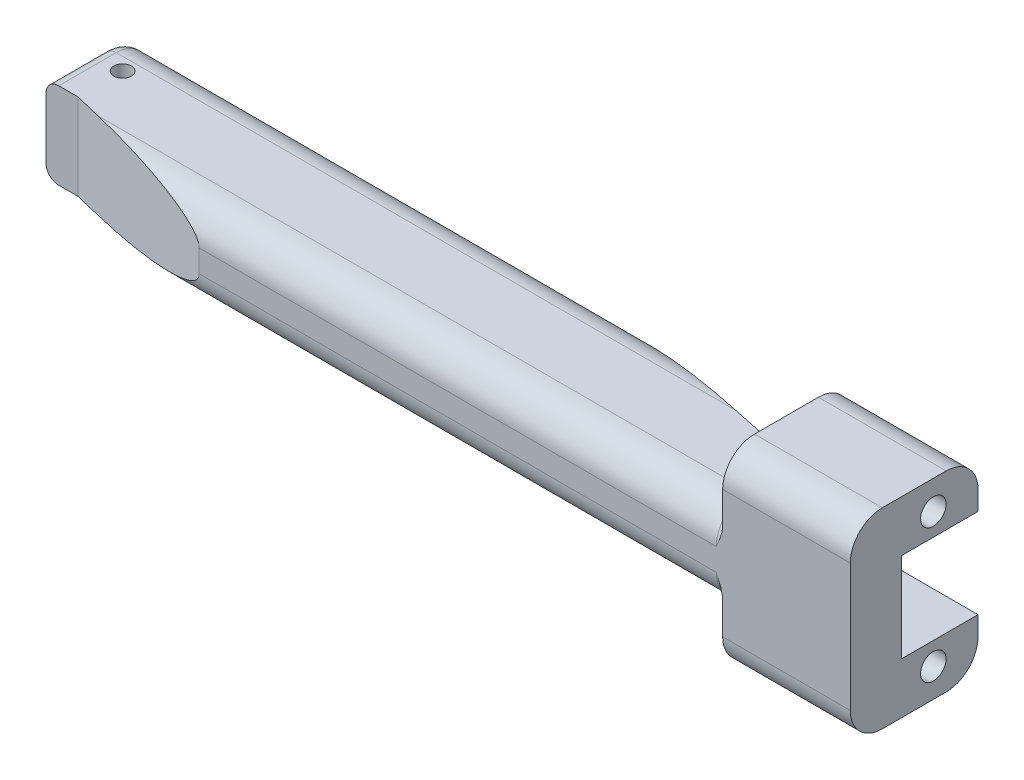
from build123d import *

# Parameters (mm, degrees)
ESQUISSE1_W                  = 132
ESQUISSE1_H                  = 30
BOSS_EXTRU_1_DEPTH           = 20
ESQUISSE3_W                  = 112
ESQUISSE3_H                  = 8.25
ENL_V_MAT_EXTRU_1_DEPTH      = 71.576199954
ENL_V_MAT_EXTRU_2_REACH      = 74.312
ESQUISSE4_R                  = 1.375
ESQUISSE5_R                  = 2
ENL_V_MAT_EXTRU_3_DEPTH      = 80
CONG_1_R                     = 5
CONG_2_R                     = 5
CONG_3_R                     = 1
ENL_V_MAT_EXTRU_4_DEPTH      = 7
ENL_V_MAT_EXTRU_4_DEPTH_BACK = 7
CONG_4_R                     = 2
ENL_V_MAT_EXTRU_5_DEPTH      = 71.576200076
ENL_V_MAT_EXTRU_5_DEPTH_BACK = 71.576200076


with BuildPart() as part:
    # Esquisse1 → Boss.-Extru.1 (new body)
    with BuildSketch(Plane.XY):
        Rectangle(ESQUISSE1_W, ESQUISSE1_H)
    extrude(amount=BOSS_EXTRU_1_DEPTH)

    # Esquisse3 → Enlèv. mat.-Extru.1 (cut, through all)
    with BuildSketch(Plane.XY.offset(20)):
        with Locations((-10, 10.875)):
            Rectangle(ESQUISSE3_W, ESQUISSE3_H)
        with Locations((-10, -10.875)):
            Rectangle(ESQUISSE3_W, ESQUISSE3_H)
    extrude(amount=-ENL_V_MAT_EXTRU_1_DEPTH, mode=Mode.SUBTRACT)

    # Esquisse4 → Enlèv. mat.-Extru.2 (cut, up to next)
    with BuildSketch(Plane.XZ.offset(6.75), mode=Mode.PRIVATE) as enl_v_mat_extru_2_sk1:
        with Locations(Location((-61, 7, 0), (0, 0, 270))):
            Circle(ESQUISSE4_R)
    enl_v_mat_extru_2_tool1 = extrude(enl_v_mat_extru_2_sk1.sketch, amount=-ENL_V_MAT_EXTRU_2_REACH, mode=Mode.PRIVATE) & part.part
    add(enl_v_mat_extru_2_tool1.solids().sort_by_distance((-61, -6.75, 7))[0], mode=Mode.SUBTRACT)

    # Esquisse5 → Enlèv. mat.-Extru.3 (cut)
    with BuildSketch(Plane.ZY.offset(-46)):
        with Locations(Location((7, -10.5, 0), (0, 0, 270))):
            Circle(ESQUISSE5_R)
        with Locations(Location((7, 10.5, 0), (0, 0, 270))):
            Circle(ESQUISSE5_R)
    extrude(amount=-ENL_V_MAT_EXTRU_3_DEPTH, mode=Mode.SUBTRACT)

    # Congé1
    cong_1_edges = [part.edges().sort_by_distance(p)[0] for p in [
        (56, -15, 0),
        (56, -15, 20),
        (56, 15, 0),
        (56, 15, 20),
    ]]
    fillet(cong_1_edges, radius=CONG_1_R)

    # Congé2
    cong_2_edges = [part.edges().sort_by_distance(p)[0] for p in [
        (-10, 6.75, 0),
        (-10, 6.75, 20),
        (-10, -6.75, 0),
        (-10, -6.75, 20),
    ]]
    fillet(cong_2_edges, radius=CONG_2_R)

    # Congé3
    # the kernel refuses this fillet: 1 mm, written as the material it adds along each edge
    with BuildSketch(Plane(origin=(46, -6.75, 15), x_dir=(0, -1, 0), z_dir=(0, 0, -1))) as cong_3_piece_1:
        with BuildLine():
            CenterArc((CONG_3_R, CONG_3_R), CONG_3_R, 180, 90)
            Line((0, CONG_3_R), (0, 0))
            Line((0, 0), (CONG_3_R, 0))
        make_face()
    extrude(amount=10)
    with BuildSketch(Plane(origin=(46, 6.75, 15), x_dir=(0, 1, 0), z_dir=(0, 0, -1))) as cong_3_piece_2:
        with BuildLine():
            CenterArc((CONG_3_R, -CONG_3_R), CONG_3_R, 90, 90)
            Line((0, -CONG_3_R), (0, 0))
            Line((0, 0), (CONG_3_R, 0))
        make_face()
    extrude(amount=10)
    with BuildSketch(Plane(origin=(46, -1.75, 15), x_dir=(0, 0.7515057138603058, 0.6597265812708415), z_dir=(0, 0.6597265812708415, -0.7515057138603058))) as cong_3_piece_3_section:
        with BuildLine():
            CenterArc((5 + CONG_3_R, -CONG_3_R), CONG_3_R, 90, 90)
            Line((5, -CONG_3_R), (5, 0))
            Line((5, 0), (5 + CONG_3_R, 0))
        make_face()
    cong_3_piece_3 = revolve(axis=Axis((46, -1.75, 15), (1, 0, 0)), revolution_arc=138.720976341, mode=Mode.PRIVATE)
    cong_3_piece_3 = split(cong_3_piece_3, bisect_by=Plane(origin=(46, -1.75, 20), z_dir=(0, 0, -1)), keep=Keep.TOP, mode=Mode.PRIVATE)
    add(cong_3_piece_3)
    with BuildSketch(Plane(origin=(46, 1.75, 15), x_dir=(0, -0.7515057138603058, 0.6597265812708415), z_dir=(0, -0.6597265812708415, -0.7515057138603058))) as cong_3_piece_4_section:
        with BuildLine():
            CenterArc((5 + CONG_3_R, CONG_3_R), CONG_3_R, 180, 90)
            Line((5, CONG_3_R), (5, 0))
            Line((5, 0), (5 + CONG_3_R, 0))
        make_face()
    cong_3_piece_4 = revolve(axis=Axis((46, 1.75, 15), (-1, 0, 0)), revolution_arc=138.720976341, mode=Mode.PRIVATE)
    cong_3_piece_4 = split(cong_3_piece_4, bisect_by=Plane(origin=(46, 1.75, 20), z_dir=(0, 0, -1)), keep=Keep.TOP, mode=Mode.PRIVATE)
    add(cong_3_piece_4)
    with BuildSketch(Plane(origin=(46, 1.75, 5), x_dir=(0, -0.7515057138603056, -0.6597265812708417), z_dir=(0, -0.6597265812708417, 0.7515057138603056))) as cong_3_piece_5_section:
        with BuildLine():
            CenterArc((5 + CONG_3_R, -CONG_3_R), CONG_3_R, 90, 90)
            Line((5, -CONG_3_R), (5, 0))
            Line((5, 0), (5 + CONG_3_R, 0))
        make_face()
    cong_3_piece_5 = revolve(axis=Axis((46, 1.75, 5), (1, 0, 0)), revolution_arc=138.720976341, mode=Mode.PRIVATE)
    cong_3_piece_5 = split(cong_3_piece_5, bisect_by=Plane(origin=(46, 1.75, 0), z_dir=(0, 0, 1)), keep=Keep.TOP, mode=Mode.PRIVATE)
    add(cong_3_piece_5)
    with BuildSketch(Plane(origin=(46, -1.75, 5), x_dir=(0, 0.7515057138603056, -0.6597265812708416), z_dir=(0, 0.6597265812708416, 0.7515057138603056))) as cong_3_piece_6_section:
        with BuildLine():
            CenterArc((5 + CONG_3_R, CONG_3_R), CONG_3_R, 180, 90)
            Line((5, CONG_3_R), (5, 0))
            Line((5, 0), (5 + CONG_3_R, 0))
        make_face()
    cong_3_piece_6 = revolve(axis=Axis((46, -1.75, 5), (-1, 0, 0)), revolution_arc=138.720976341, mode=Mode.PRIVATE)
    cong_3_piece_6 = split(cong_3_piece_6, bisect_by=Plane(origin=(46, -1.75, 0), z_dir=(0, 0, 1)), keep=Keep.TOP, mode=Mode.PRIVATE)
    add(cong_3_piece_6)

    # Esquisse7 → Enlèv. mat.-Extru.4 (cut, two sides: drawn at the far end of the back side and taken through both)
    with BuildSketch(Plane(origin=(0, 0, 0), x_dir=(1, 0, 0), z_dir=(0, 1, 0)).offset(-ENL_V_MAT_EXTRU_4_DEPTH_BACK)):
        Polygon((66, -12), (9.544438686, 0), (66, 0), align=None)
    extrude(amount=ENL_V_MAT_EXTRU_4_DEPTH + ENL_V_MAT_EXTRU_4_DEPTH_BACK, mode=Mode.SUBTRACT)

    # Congé4
    cong_4_edges = [part.edges().sort_by_distance(p)[0] for p in [
        (-66, -6.75, 10),
        (-66, 0, 20),
        (-66, 6.75, 10),
        (-66, 0, 0),
        (-66, -5.285533906, 1.464466094),
        (-66, 5.285533906, 1.464466094),
        (-66, 5.285533906, 18.535533906),
        (-66, -5.285533906, 18.535533906),
    ]]
    fillet(cong_4_edges, radius=CONG_4_R)

    # Esquisse8 → Enlèv. mat.-Extru.5 (cut, two sides: drawn at the far end of the back side and taken through both)
    with BuildSketch(Plane(origin=(0, 0, 0), x_dir=(1, 0, 0), z_dir=(0, 1, 0)).offset(-ENL_V_MAT_EXTRU_5_DEPTH_BACK)):
        Polygon((-36, -20), (-66, -20), (-66, -14), (-61, -14), align=None)
    extrude(amount=ENL_V_MAT_EXTRU_5_DEPTH + ENL_V_MAT_EXTRU_5_DEPTH_BACK, mode=Mode.SUBTRACT)


solid = part.part
